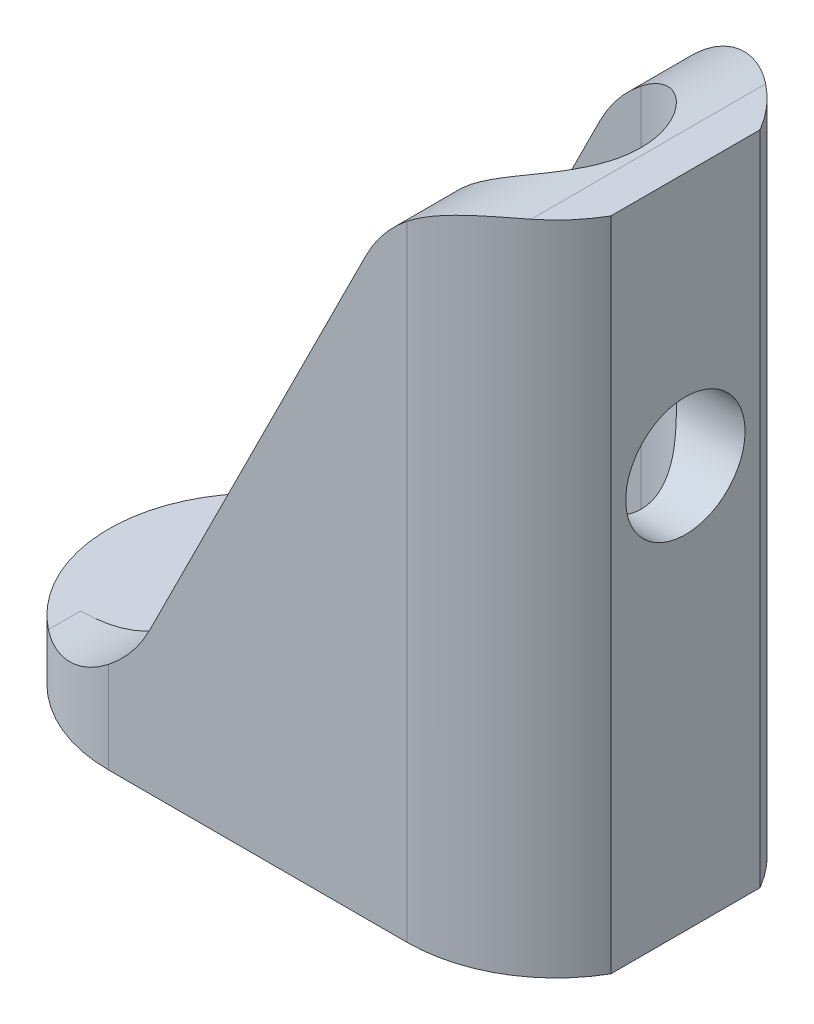
from build123d import *

# Parameters (mm, degrees)
BOSS_EXTRUDE1_DEPTH = 2
SKETCH2_W           = 10
SKETCH2_H           = 2.15
BOSS_EXTRUDE2_DEPTH = 20
CUT_EXTRUDE1_DEPTH  = 29.442925307
FILLET1_START       = -6
FILLET1_DEPTH       = 12
FILLET1_START_2     = 2.85
FILLET1_2_DEPTH     = 1.775923077
FILLET1_START_3     = -4.604846154
FILLET1_3_DEPTH     = 1.754846154
FILLET1_START_4     = -5
FILLET1_4_DEPTH     = 0.395153846
FILLET1_START_5     = 4.625923077
FILLET1_5_DEPTH     = 0.374076923
FILLET1_START_6     = 2
FILLET1_6_DEPTH     = 2.763932023
CUT_EXTRUDE2_DEPTH  = 28.092434523
SKETCH5_R           = 2
CUT_EXTRUDE3_DEPTH  = 30.709490335


with BuildPart() as part:
    # Sketch1 → Boss-Extrude1 (new body)
    with BuildSketch(Plane(origin=(0, 0, 0), x_dir=(1, 0, 0), z_dir=(0, 1, 0))):
        with BuildLine():
            Line((0, 5), (10, 5))
            ThreePointArc((10, 5), (15, 0), (10, -5))
            Line((10, -5), (0, -5))
            ThreePointArc((0, -5), (-5, 0), (0, 5))
        make_face()
        with BuildLine():
            Line((0, 2), (10, 2))
            ThreePointArc((10, 2), (12, 0), (10, -2))
            Line((10, -2), (0, -2))
            ThreePointArc((0, -2), (-2, 0), (0, 2))
        make_face(mode=Mode.SUBTRACT)
    extrude(amount=BOSS_EXTRUDE1_DEPTH)

    # Sketch2 → Boss-Extrude2 (add)
    with BuildSketch(Plane(origin=(0, 2, 0), x_dir=(1, 0, 0), z_dir=(0, 1, 0))):
        with BuildLine():
            ThreePointArc((10, -2.85), (12.85, 0), (10, 2.85))
            Line((10, 2.85), (10, 5))
            ThreePointArc((10, 5), (15, 0), (10, -5))
            Line((10, -5), (10, -2.85))
        make_face()
        with Locations((5, 3.925)):
            Rectangle(SKETCH2_W, SKETCH2_H)
        with Locations((5, -3.925)):
            Rectangle(SKETCH2_W, SKETCH2_H)
    extrude(amount=BOSS_EXTRUDE2_DEPTH)

    # Sketch3 → Cut-Extrude1 (cut, through all)
    with BuildSketch(Plane(origin=(0, 0, -5), x_dir=(-1, 0, 0), z_dir=(0, 0, -1))):
        Polygon((0, 2), (-10, 22), (0, 22), align=None)
    extrude(amount=-CUT_EXTRUDE1_DEPTH, mode=Mode.SUBTRACT)

    # Fillet1: read off the stored shape, not the designer's step
    # Fillet1 outline → Fillet1 (cut)
    with BuildSketch(Plane.XY.offset(FILLET1_START)):
        with BuildLine():
            ThreePointArc((8.618033989, 19.236067977), (10.461514383, 21.253254042), (13.090169944, 22))
            Line((13.090169944, 22), (10, 22))
            Line((10, 22), (8.618033989, 19.236067977))
        make_face()
    extrude(amount=FILLET1_DEPTH, mode=Mode.SUBTRACT)

    # Fillet1 2 outline → Fillet1 2 (add)
    with BuildSketch(Plane.XY.offset(FILLET1_START_2)):
        with BuildLine():
            Line((0, 2), (1.381966011, 4.763932023))
            ThreePointArc((1.381966011, 4.763932023), (-0.461514383, 2.746745958), (-3.090169944, 2))
            Line((-3.090169944, 2), (0, 2))
        make_face()
    extrude(amount=FILLET1_2_DEPTH)

    # Fillet1 3 outline → Fillet1 3 (add)
    with BuildSketch(Plane.XY.offset(FILLET1_START_3)):
        with BuildLine():
            Line((0, 2), (1.381966011, 4.763932023))
            ThreePointArc((1.381966011, 4.763932023), (-0.461514383, 2.746745958), (-3.090169944, 2))
            Line((-3.090169944, 2), (0, 2))
        make_face()
    extrude(amount=FILLET1_3_DEPTH)

    # Fillet1 4 outline → Fillet1 4 (add)
    with BuildSketch(Plane.XY.offset(FILLET1_START_4)):
        with BuildLine():
            Line((0, 2), (1.381966011, 4.763932023))
            ThreePointArc((1.381966011, 4.763932023), (-0.461514383, 2.746745958), (-3.090169944, 2))
            Line((-3.090169944, 2), (0, 2))
        make_face()
    extrude(amount=FILLET1_4_DEPTH)

    # Fillet1 5 outline → Fillet1 5 (add)
    with BuildSketch(Plane.XY.offset(FILLET1_START_5)):
        with BuildLine():
            Line((0, 2), (1.381966011, 4.763932023))
            ThreePointArc((1.381966011, 4.763932023), (-0.461514383, 2.746745958), (-3.090169944, 2))
            Line((-3.090169944, 2), (0, 2))
        make_face()
    extrude(amount=FILLET1_5_DEPTH)

    # Fillet1 6 outline → Fillet1 6 (cut)
    with BuildSketch(Plane(origin=(0, 0, 0), x_dir=(1, 0, 0), z_dir=(0, 1, 0)).offset(FILLET1_START_6)):
        with BuildLine():
            Line((-5, -5), (0, -5))
            ThreePointArc((0, -5), (-3.535533906, -3.535533906), (-5, 0))
            Line((-5, 0), (-5, -5))
        make_face()
        with BuildLine():
            Line((-5, 5), (-5, 0))
            ThreePointArc((-5, 0), (-3.535533906, 3.535533906), (0, 5))
            Line((0, 5), (-5, 5))
        make_face()
    extrude(amount=FILLET1_6_DEPTH, mode=Mode.SUBTRACT)

    # Sketch4 → Cut-Extrude2 (cut, through all)
    with BuildSketch(Plane.XZ):
        with BuildLine():
            Line((14.330127019, 2.5), (14.330127019, -2.5))
            ThreePointArc((14.330127019, -2.5), (15, 0), (14.330127019, 2.5))
        make_face()
    extrude(amount=-CUT_EXTRUDE2_DEPTH, mode=Mode.SUBTRACT)

    # Sketch5 → Cut-Extrude3 (cut, through all)
    with BuildSketch(Plane(origin=(14.330127019, 0, 0), x_dir=(0, 0, -1), z_dir=(1, 0, 0))):
        with Locations((0, 13.5)):
            Circle(SKETCH5_R)
    extrude(amount=-CUT_EXTRUDE3_DEPTH, mode=Mode.SUBTRACT)


solid = part.part
